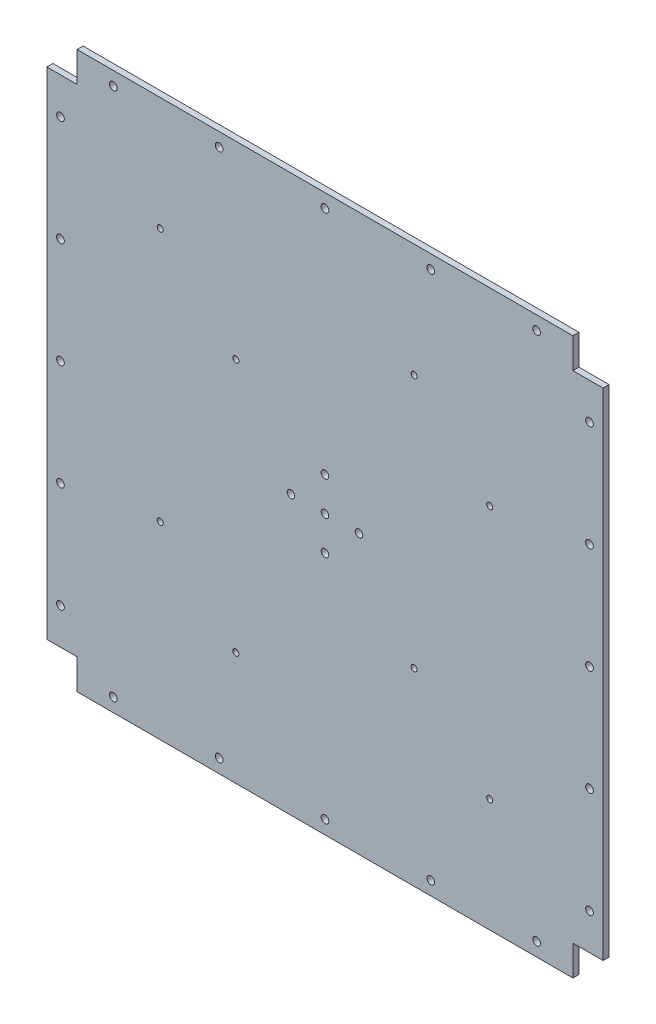
from build123d import *

# Parameters (mm, degrees)
SKETCH_1_W          = 368
SKETCH_1_H          = 368
EXTRUDE_1_DEPTH     = 4
SKETCH_3_R          = 2.55
CUT_EXTRUDE_2_DEPTH = 261.246037434
SKETCH_4_W          = 20
SKETCH_4_H          = 20
CUT_EXTRUDE_3_DEPTH = 261.246037434
SKETCH_5_R          = 2.5
CUT_EXTRUDE_6_DEPTH = 10
SKETCH_6_R          = 2
CUT_EXTRUDE_7_DEPTH = 10


with BuildPart() as part:
    # 草图1 → 凸台-拉伸1 (new body)
    with BuildSketch(Plane.XY):
        Rectangle(SKETCH_1_W, SKETCH_1_H)
    extrude(amount=EXTRUDE_1_DEPTH)

    # 草图3 → 切除-拉伸2 (cut, through all)
    with BuildSketch(Plane.XY.offset(4)):
        with Locations((0, -175)):
            Circle(SKETCH_3_R)
        with Locations((70, -175)):
            Circle(SKETCH_3_R)
        with Locations((140, -175)):
            Circle(SKETCH_3_R)
        with Locations((-70, -175)):
            Circle(SKETCH_3_R)
        with Locations((-140, -175)):
            Circle(SKETCH_3_R)
        with Locations((-175, 140)):
            Circle(SKETCH_3_R)
        with Locations((-175, 70)):
            Circle(SKETCH_3_R)
        with Locations((-175, -70)):
            Circle(SKETCH_3_R)
        with Locations((-175, -140)):
            Circle(SKETCH_3_R)
        with Locations((-175, 0)):
            Circle(SKETCH_3_R)
        with Locations((140, 175)):
            Circle(SKETCH_3_R)
        with Locations((70, 175)):
            Circle(SKETCH_3_R)
        with Locations((-70, 175)):
            Circle(SKETCH_3_R)
        with Locations((-140, 175)):
            Circle(SKETCH_3_R)
        with Locations((0, 175)):
            Circle(SKETCH_3_R)
        with Locations((175, -140)):
            Circle(SKETCH_3_R)
        with Locations((175, -70)):
            Circle(SKETCH_3_R)
        with Locations((175, 70)):
            Circle(SKETCH_3_R)
        with Locations((175, 140)):
            Circle(SKETCH_3_R)
        with Locations((175, 0)):
            Circle(SKETCH_3_R)
    extrude(amount=-CUT_EXTRUDE_2_DEPTH, mode=Mode.SUBTRACT)

    # 草图4 → 切除-拉伸3 (cut, through all)
    with BuildSketch(Plane.XY.offset(4)):
        with Locations((-174, 174)):
            Rectangle(SKETCH_4_W, SKETCH_4_H)
        with Locations((-174, -174)):
            Rectangle(SKETCH_4_W, SKETCH_4_H)
        with Locations((174, 174)):
            Rectangle(SKETCH_4_W, SKETCH_4_H)
        with Locations((174, -174)):
            Rectangle(SKETCH_4_W, SKETCH_4_H)
    extrude(amount=-CUT_EXTRUDE_3_DEPTH, mode=Mode.SUBTRACT)

    # 草图5 → 切除-拉伸6 (cut)
    with BuildSketch(Plane.XY.offset(4)):
        with Locations((0, 22.5)):
            Circle(SKETCH_5_R)
        with Locations((22.5, 0)):
            Circle(SKETCH_5_R)
        with Locations((-22.5, 0)):
            Circle(SKETCH_5_R)
        with Locations((0, -22.5)):
            Circle(SKETCH_5_R)
        Circle(SKETCH_5_R)
    extrude(amount=-CUT_EXTRUDE_6_DEPTH, mode=Mode.SUBTRACT)

    # 草图6 → 切除-拉伸7 (cut)
    with BuildSketch(Plane.XY.offset(4)):
        with Locations((-108.99, 108.99)):
            Circle(SKETCH_6_R)
        with Locations((-58.99, 58.99)):
            Circle(SKETCH_6_R)
        with Locations((58.99, 108.99)):
            Circle(SKETCH_6_R)
        with Locations((108.99, 58.99)):
            Circle(SKETCH_6_R)
        with Locations((58.99, -58.99)):
            Circle(SKETCH_6_R)
        with Locations((108.99, -108.99)):
            Circle(SKETCH_6_R)
        with Locations((-58.99, -108.99)):
            Circle(SKETCH_6_R)
        with Locations((-108.99, -58.99)):
            Circle(SKETCH_6_R)
    extrude(amount=-CUT_EXTRUDE_7_DEPTH, mode=Mode.SUBTRACT)


solid = part.part
